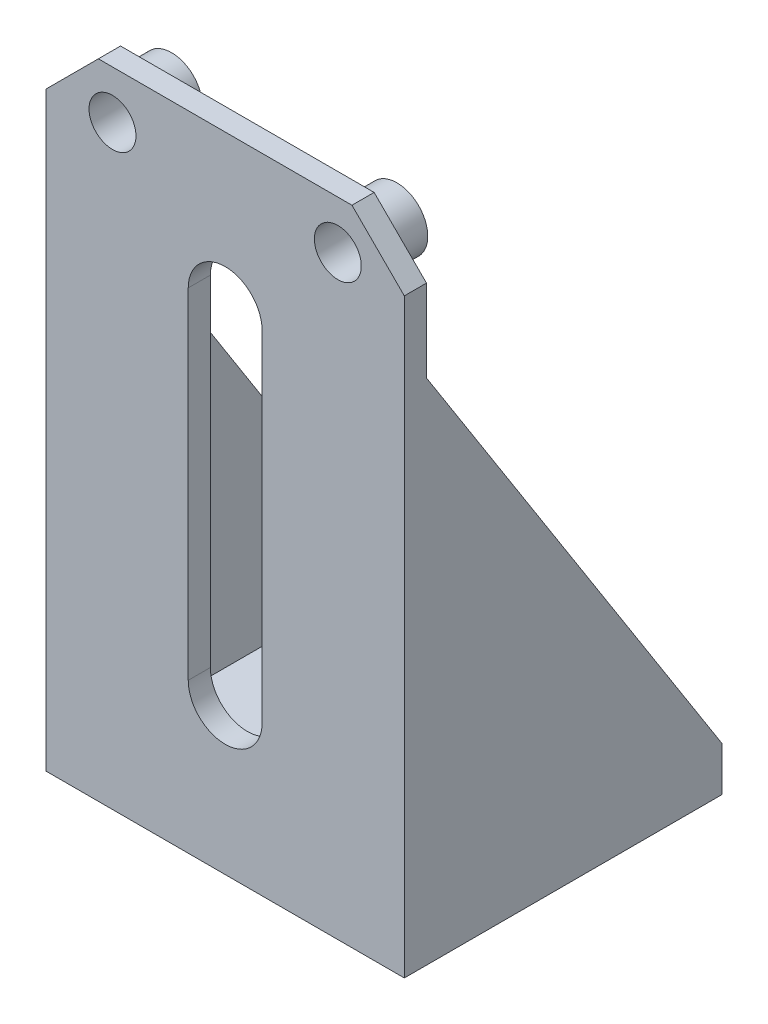
from build123d import *
from build123d.topology import SkipClean

# Parameters (mm, degrees)
SKETCH1_R                = 1.55
SKETCH1_R_2              = 1.5
SKETCH1_R_3              = 11
SKETCH1_R_4              = 3.175
BOSS_EXTRUDE1_DEPTH      = 3
BOSS_EXTRUDE2_START      = 3
SKETCH2_R                = 4.175
SKETCH2_R_2              = 3.175
BOSS_EXTRUDE2_DEPTH      = 3
BOSS_EXTRUDE3_START      = 2
SKETCH3_R                = 4.175
BOSS_EXTRUDE3_DEPTH      = 2
BOSS_EXTRUDE4_DEPTH      = 40
BOSS_EXTRUDE4_DEPTH_BACK = 3
SKETCH5_W                = 3
SKETCH5_H                = 5
BOSS_EXTRUDE5_DEPTH      = 3
BOSS_EXTRUDE7_DEPTH      = 3
BOSS_EXTRUDE9_DEPTH      = 3
BOSS_EXTRUDE10_START     = -3
SKETCH9_R                = 1.55
SKETCH9_R_2              = 1.5
SKETCH9_R_3              = 11
BOSS_EXTRUDE10_DEPTH     = 3
CUT_EXTRUDE1_DEPTH       = 3
SKETCH11_W               = 3
SKETCH11_H               = 75.55
BOSS_EXTRUDE11_DEPTH     = 3
CHAMFER1_SIZE            = 3
BOSS_EXTRUDE12_DEPTH     = 3
BOSS_EXTRUDE13_DEPTH     = 3
BOSS_EXTRUDE14_DEPTH     = 3


with BuildPart() as part:
    # Sketch1 → Boss-Extrude1 (new body)
    with BuildSketch(Plane.XY):
        Polygon((-33.421286346, -6), (-33.421286346, 36.5), (-33.421286346, 72.55), (-28.421286346, 77.55), (4.078713654, 77.55), (9.078713654, 72.55), (9.078713654, 36.5), (9.078713654, -6), align=None)
        with Locations((2.92772434, 30.5)):
            Circle(SKETCH1_R, mode=Mode.SUBTRACT)
        with Locations(Location((2.92772434, -0.5, 0), (0, 0, 180))):
            Circle(SKETCH1_R_2, mode=Mode.SUBTRACT)
        with Locations((-27.671286346, -0.5)):
            Circle(SKETCH1_R_2, mode=Mode.SUBTRACT)
        with Locations(Location((-28.07227566, 30.5, 0), (0, 0, 180))):
            Circle(SKETCH1_R_2, mode=Mode.SUBTRACT)
        with Locations((-12.171286346, 15.25)):
            Circle(SKETCH1_R_3, mode=Mode.SUBTRACT)
        with Locations((-27.421286346, 71.55)):
            Circle(SKETCH1_R_4, mode=Mode.SUBTRACT)
        with Locations(Location((3.078713654, 71.55, 0), (0, 0, 180))):
            Circle(SKETCH1_R_4, mode=Mode.SUBTRACT)
    extrude(amount=BOSS_EXTRUDE1_DEPTH)

    # Sketch2 → Boss-Extrude2 (add)
    # profile 1 of 2: a face of its own
    with SkipClean():  # the faces are left unmerged after this step: merging them gives an invalid solid
        with BuildSketch(Plane(origin=(0, 0, 0), x_dir=(-1, 0, 0), z_dir=(0, 0, -1)).offset(BOSS_EXTRUDE2_START)):
            with Locations((-3.078713654, 71.55)):
                Circle(SKETCH2_R)
            with Locations((-3.078713654, 71.55)):
                Circle(SKETCH2_R_2, mode=Mode.SUBTRACT)
        # profile 2 of 2: a face of its own
        with BuildSketch(Plane(origin=(0, 0, 0), x_dir=(-1, 0, 0), z_dir=(0, 0, -1)).offset(BOSS_EXTRUDE2_START)):
            with Locations((27.421286346, 71.55)):
                Circle(SKETCH2_R)
            with Locations((27.421286346, 71.55)):
                Circle(SKETCH2_R_2, mode=Mode.SUBTRACT)
        extrude(amount=-BOSS_EXTRUDE2_DEPTH)

    # Sketch3 → Boss-Extrude3 (add)
    with SkipClean():  # the faces are left unmerged after this step: merging them gives an invalid solid
        with BuildSketch(Plane(origin=(0, 0, -3), x_dir=(-1, 0, 0), z_dir=(0, 0, -1)).offset(BOSS_EXTRUDE3_START)):
            with Locations((-3.078713654, 71.55)):
                Circle(SKETCH3_R)
            with Locations((27.421286346, 71.55)):
                Circle(SKETCH3_R)
        extrude(amount=-BOSS_EXTRUDE3_DEPTH)

    # Sketch5 → Boss-Extrude5 (add)
    with SkipClean():  # the faces are left unmerged after this step: merging them gives an invalid solid
        with BuildSketch(Plane.XY.offset(3)):
            with Locations((10.578713654, 45.531399611)):
                Rectangle(SKETCH5_W, SKETCH5_H)
            with Locations((-34.921286346, 45.531399611)):
                Rectangle(SKETCH5_W, SKETCH5_H)
        extrude(amount=-BOSS_EXTRUDE5_DEPTH)



with BuildPart() as body_2:
    # Sketch4 → Boss-Extrude4 (new, two sides: drawn at the far end of the back side and taken through both)
    with BuildSketch(Plane(origin=(0, 0, 0), x_dir=(-1, 0, 0), z_dir=(0, 0, -1)).offset(-BOSS_EXTRUDE4_DEPTH_BACK)):
        Polygon((33.421286346, -6), (-9.078713654, -6), (-9.078713654, -3), (-12.078713654, -3), (-12.078713654, -9), (-9.078713654, -9), (34.421286346, -9), (36.421286346, -9), (36.421286346, -3), (33.421286346, -3), align=None)
    extrude(amount=BOSS_EXTRUDE4_DEPTH + BOSS_EXTRUDE4_DEPTH_BACK)


with BuildPart() as part_1:
    with SkipClean():  # the faces are left unmerged after this step: merging them gives an invalid solid
        add(part.part)

        add(body_2.part)  # Boss-Extrude7 merges body 2
        # Sketch6 → Boss-Extrude7 (add)
        with BuildSketch(Plane(origin=(9.078713654, 0, 0), x_dir=(0, 0, -1), z_dir=(1, 0, 0))):
            Polygon((0, 48.031399611), (40, -3), (36.080844313, -3), (0, 43.031399611), align=None)
        extrude(amount=BOSS_EXTRUDE7_DEPTH)

    # Sketch8 → Boss-Extrude9 (add)
    with SkipClean():  # the faces are left unmerged after this step: merging them gives an invalid solid
        with BuildSketch(Plane.ZY.offset(36.421286346)):
            Polygon((0, 48.031399611), (0, 43.031399611), (-36.080844313, -3), (-40, -3), align=None)
        extrude(amount=-BOSS_EXTRUDE9_DEPTH)

    # Sketch9 → Boss-Extrude10 (add)
    with SkipClean():  # the faces are left unmerged after this step: merging them gives an invalid solid
        with BuildSketch(Plane.XY.offset(3).offset(BOSS_EXTRUDE10_START)):
            with Locations((2.92772434, 30.5)):
                Circle(SKETCH9_R)
            with Locations((-28.07227566, 30.5)):
                Circle(SKETCH9_R_2)
            with Locations((-27.671286346, -0.5)):
                Circle(SKETCH9_R_2)
            with Locations((2.92772434, -0.5)):
                Circle(SKETCH9_R_2)
            with Locations((-12.171286346, 15.25)):
                Circle(SKETCH9_R_3)
        extrude(amount=BOSS_EXTRUDE10_DEPTH)

    # Sketch10 → Cut-Extrude1 (cut)
    with BuildSketch(Plane.XY.offset(3)):
        with BuildLine():
            Line((-7.171286346, 57.275), (-7.171286346, 11.275))
            ThreePointArc((-7.171286346, 11.275), (-12.171286346, 6.275), (-17.171286346, 11.275))
            Line((-17.171286346, 11.275), (-17.171286346, 57.275))
            ThreePointArc((-17.171286346, 57.275), (-12.171286346, 62.275), (-7.171286346, 57.275))
        make_face()
    extrude(amount=-CUT_EXTRUDE1_DEPTH, mode=Mode.SUBTRACT)

    # Sketch11 → Boss-Extrude11 (add)
    with BuildSketch(Plane.XY.offset(3)):
        with Locations((-34.921286346, 34.775)):
            Rectangle(SKETCH11_W, SKETCH11_H)
        with Locations((10.578713654, 34.775)):
            Rectangle(SKETCH11_W, SKETCH11_H)
    extrude(amount=-BOSS_EXTRUDE11_DEPTH)

    # Chamfer1
    chamfer1_edges = [part_1.edges().sort_by_distance(p)[0] for p in [
        (-36.421286346, 72.55, 1.5),
        (12.078713654, 72.55, 1.5),
    ]]
    chamfer(chamfer1_edges, length=CHAMFER1_SIZE - 0.0001)  # a hair under: the kernel refuses the full size

    # Sketch12 → Boss-Extrude12 (add)
    with BuildSketch(Plane(origin=(12.078713654, 0, 0), x_dir=(0, 0, -1), z_dir=(1, 0, 0))):
        Polygon((-3, 64.55), (-3, -9), (40, -9), (40, -3), align=None)
    extrude(amount=-BOSS_EXTRUDE12_DEPTH)

    # Sketch13 → Boss-Extrude13 (add)
    with BuildSketch(Plane.ZY.offset(36.421286346)):
        Polygon((3, -9), (3, 64.55), (-40, -3), (-40, -9), align=None)
    extrude(amount=-BOSS_EXTRUDE13_DEPTH)

    # Sketch14 → Boss-Extrude14 (add)
    with BuildSketch(Plane.XY.offset(3)):
        Polygon((-36.421286346, 70.964213562), (-36.421286346, 69.55), (-28.421286346, 77.55), (4.078713654, 77.55), (12.078713654, 69.55), (12.078713654, 70.964213562), (4.992927216, 78.05), (-29.335499908, 78.05), align=None)
    extrude(amount=-BOSS_EXTRUDE14_DEPTH)


solid = part_1.part
